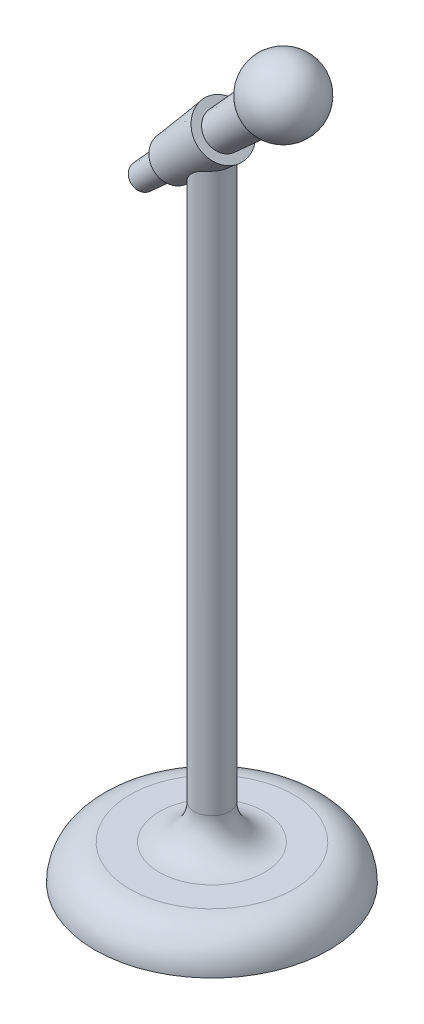
from build123d import *

# Parameters (mm, degrees)
FILLET1_R           = 6
BOSS_EXTRUDE1_START = -19.5
SKETCH3_R           = 4.5
BOSS_EXTRUDE1_DEPTH = 12
BOSS_EXTRUDE1_TAPER = 5
FILLET2_R           = 6


with BuildPart() as part:
    # Sketch1 → Revolve1 (revolve)
    with BuildSketch(Plane.XY, mode=Mode.PRIVATE) as revolve1_sk:
        Polygon((0, 110), (-3, 110), (-3, 6), (-20, 6), (-20, 0), (0, 0), align=None)
    revolve(revolve1_sk.sketch.rotate(Axis((0, 110, 0), (0, -1, 0)), 270), axis=Axis((0, 110, 0), (0, -1, 0)))

    # Fillet1
    fillet1_edges = [part.edges().sort_by_distance(p)[0] for p in [
        (0, 6, -3),
    ]]
    fillet(fillet1_edges, radius=FILLET1_R)

    # Sketch2 → Revolve2 (revolve)
    with BuildSketch(Plane.XY, mode=Mode.PRIVATE) as revolve2_sk:
        with BuildLine():
            Line((-11.852035479, 98.544183465), (-13.266249042, 99.958397027))
            Line((-13.266249042, 99.958397027), (6.263312277, 121.648172237))
            ThreePointArc((6.263312277, 121.648172237), (9.466087356, 127.932074931), (16.432235768, 126.828454712))
            Line((16.432235768, 126.828454712), (-11.852035479, 98.544183465))
        make_face()
    revolve(revolve2_sk.sketch.rotate(Axis((-11.852035479, 98.544183465, 0), (0.7071067811865513, 0.7071067811865438, 0)), 180), axis=Axis((-11.852035479, 98.544183465, 0), (0.7071067811865513, 0.7071067811865438, 0)))

    # Sketch3 → Boss-Extrude1 (add)
    with BuildSketch(Plane(origin=(43.346073993, 43.346073993, 0), x_dir=(0, 0, 1), z_dir=(-0.7071067811865513, -0.7071067811865437, 0)).offset(BOSS_EXTRUDE1_START)):
        with Locations((0, 78.061915033)):
            Circle(SKETCH3_R)
    extrude(amount=BOSS_EXTRUDE1_DEPTH, taper=BOSS_EXTRUDE1_TAPER)

    # Fillet2
    fillet2_edges = [part.edges().sort_by_distance(p)[0] for p in [
        (0, 6, -20),
    ]]
    fillet(fillet2_edges, radius=FILLET2_R - 0.0001)  # a hair under: the kernel refuses the full size


solid = part.part
